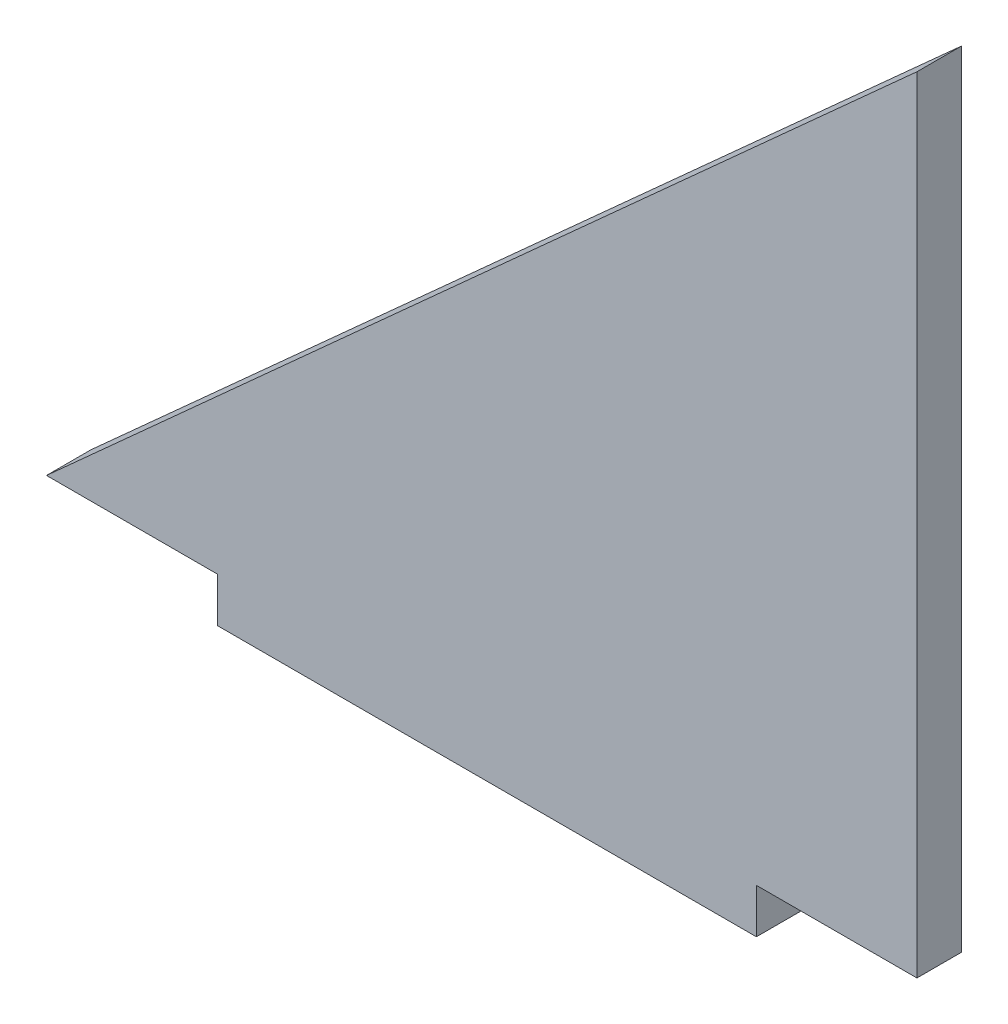
from build123d import *

# Parameters (mm, degrees)
BOSS_EXTRUDE1_DEPTH = 3.175


with BuildPart() as part:
    # Sketch1 → Boss-Extrude1 (new body)
    with BuildSketch(Plane.XY):
        Polygon((-61.976, 0), (0, 55.88), (0, 0), (-11.43, 0), (-11.43, -3.175), (-49.784, -3.175), (-49.784, 0), align=None)
    extrude(amount=BOSS_EXTRUDE1_DEPTH)


solid = part.part
